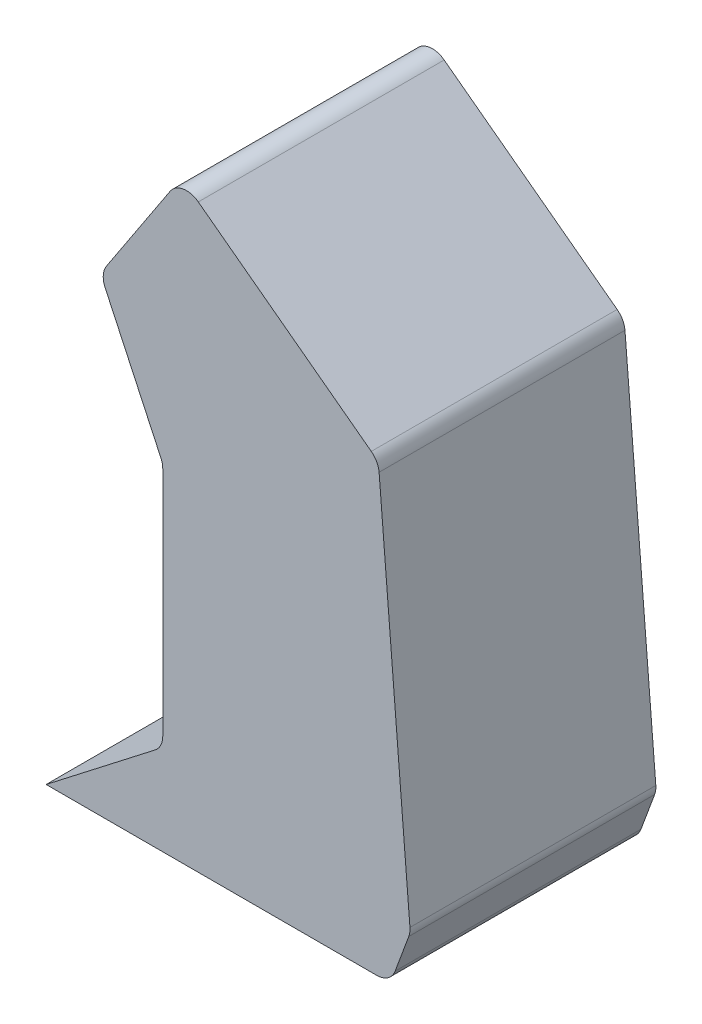
from build123d import *

# Parameters (mm, degrees)
BOSS_EXTRUDE4_DEPTH      = 250
BOSS_EXTRUDE4_DEPTH_BACK = 250


with BuildPart() as part:
    # Sketch5 → Boss-Extrude4 (new, two sides: drawn at the far end of the back side and taken through both)
    with BuildSketch(Plane.XY.offset(-BOSS_EXTRUDE4_DEPTH_BACK)):
        with BuildLine():
            Line((0, 0), (672.171335821, 0))
            ThreePointArc((672.171335821, 0), (695.015340994, 7.164783727), (709.67572834, 26.092428616))
            Line((709.67572834, 26.092428616), (737.471676481, 101.049451717))
            ThreePointArc((737.471676481, 101.049451717), (739.592893447, 109.497071364), (739.835315655, 118.203567248))
            Line((739.835315655, 118.203567248), (677.113885207, 888.431804819))
            ThreePointArc((677.113885207, 888.431804819), (672.259409474, 904.525656196), (661.221146145, 917.203776303))
            Line((661.221146145, 917.203776303), (309.427255987, 1180.62515285))
            ThreePointArc((309.427255987, 1180.62515285), (278.574694363, 1188.010991942), (252.048068947, 1170.610724074))
            Line((252.048068947, 1170.610724074), (122.680980621, 974.221544796))
            ThreePointArc((122.680980621, 974.221544796), (116.191514126, 955.136320019), (119.833938538, 935.309779107))
            Line((119.833938538, 935.309779107), (233.447211318, 691.717055548))
            ThreePointArc((233.447211318, 691.717055548), (236.247763017, 683.468549318), (237.196274827, 674.809376715))
            Line((237.196274827, 674.809376715), (237.196274827, 203.294882782))
            ThreePointArc((237.196274827, 203.294882782), (233.110204151, 185.682680179), (221.6867908, 171.668712805))
            Line((221.6867908, 171.668712805), (0, 0))
        make_face()
    extrude(amount=BOSS_EXTRUDE4_DEPTH + BOSS_EXTRUDE4_DEPTH_BACK)


solid = part.part
